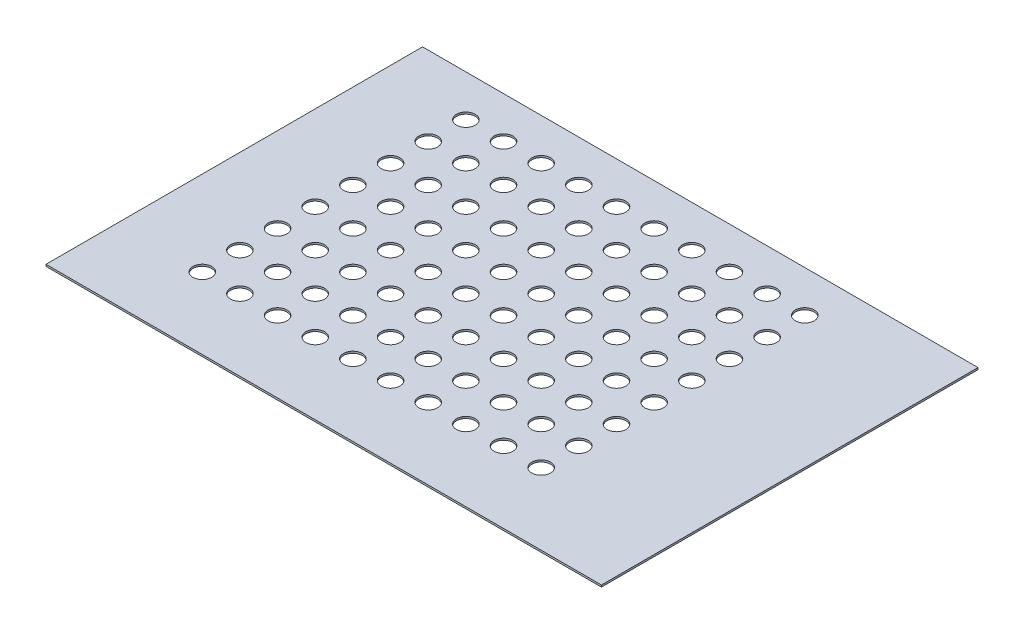
from build123d import *

# Parameters (mm, degrees)
SKETCH1_W          = 295
SKETCH1_H          = 200
BASE_FLANGE1_DEPTH = 1
SKETCH2_R          = 5
CUT_EXTRUDE1_DEPTH = 224.986144874


# Sheet-metal steps are written as plain solids
with BuildPart() as part:
    # Sketch1 → Base-Flange1 (new body)
    with BuildSketch(Plane(origin=(0, 0, 0), x_dir=(1, 0, 0), z_dir=(0, 1, 0))):
        with Locations((38.996598639, -24.047619048)):
            Rectangle(SKETCH1_W, SKETCH1_H)
    extrude(amount=-BASE_FLANGE1_DEPTH)

    # Sketch2 → Cut-Extrude1 (cut, through all)
    with BuildSketch(Plane(origin=(0, 0, 0), x_dir=(1, 0, 0), z_dir=(0, 1, 0))):
        with Locations(Location((-63.503401361, 53.952079096, 0), (0, 0, 270))):
            Circle(SKETCH2_R)
        with Locations(Location((-63.503401361, 33.952079096, 0), (0, 0, 270))):
            Circle(SKETCH2_R)
        with Locations(Location((-63.503401361, 13.952079096, 0), (0, 0, 270))):
            Circle(SKETCH2_R)
        with Locations(Location((-63.503401361, -6.047920904, 0), (0, 0, 270))):
            Circle(SKETCH2_R)
        with Locations(Location((-63.503401361, -26.047920904, 0), (0, 0, 270))):
            Circle(SKETCH2_R)
        with Locations(Location((-63.503401361, -46.047920904, 0), (0, 0, 270))):
            Circle(SKETCH2_R)
        with Locations(Location((-63.503401361, -66.047920904, 0), (0, 0, 270))):
            Circle(SKETCH2_R)
        with Locations(Location((-63.503401361, -86.047920904, 0), (0, 0, 270))):
            Circle(SKETCH2_R)
        with Locations(Location((-43.503401361, 53.952079096, 0), (0, 0, 270))):
            Circle(SKETCH2_R)
        with Locations(Location((-43.503401361, 33.952079096, 0), (0, 0, 270))):
            Circle(SKETCH2_R)
        with Locations(Location((-43.503401361, 13.952079096, 0), (0, 0, 270))):
            Circle(SKETCH2_R)
        with Locations(Location((-43.503401361, -6.047920904, 0), (0, 0, 270))):
            Circle(SKETCH2_R)
        with Locations(Location((-43.503401361, -26.047920904, 0), (0, 0, 270))):
            Circle(SKETCH2_R)
        with Locations(Location((-43.503401361, -46.047920904, 0), (0, 0, 270))):
            Circle(SKETCH2_R)
        with Locations(Location((-43.503401361, -66.047920904, 0), (0, 0, 270))):
            Circle(SKETCH2_R)
        with Locations(Location((-43.503401361, -86.047920904, 0), (0, 0, 270))):
            Circle(SKETCH2_R)
        with Locations(Location((-23.503401361, 53.952079096, 0), (0, 0, 270))):
            Circle(SKETCH2_R)
        with Locations(Location((-23.503401361, 33.952079096, 0), (0, 0, 270))):
            Circle(SKETCH2_R)
        with Locations(Location((-23.503401361, 13.952079096, 0), (0, 0, 270))):
            Circle(SKETCH2_R)
        with Locations(Location((-23.503401361, -6.047920904, 0), (0, 0, 270))):
            Circle(SKETCH2_R)
        with Locations(Location((-23.503401361, -26.047920904, 0), (0, 0, 270))):
            Circle(SKETCH2_R)
        with Locations(Location((-23.503401361, -46.047920904, 0), (0, 0, 270))):
            Circle(SKETCH2_R)
        with Locations(Location((-23.503401361, -66.047920904, 0), (0, 0, 270))):
            Circle(SKETCH2_R)
        with Locations(Location((-23.503401361, -86.047920904, 0), (0, 0, 270))):
            Circle(SKETCH2_R)
        with Locations(Location((-3.503401361, 53.952079096, 0), (0, 0, 270))):
            Circle(SKETCH2_R)
        with Locations(Location((-3.503401361, 33.952079096, 0), (0, 0, 270))):
            Circle(SKETCH2_R)
        with Locations(Location((-3.503401361, 13.952079096, 0), (0, 0, 270))):
            Circle(SKETCH2_R)
        with Locations(Location((-3.503401361, -6.047920904, 0), (0, 0, 270))):
            Circle(SKETCH2_R)
        with Locations(Location((-3.503401361, -26.047920904, 0), (0, 0, 270))):
            Circle(SKETCH2_R)
        with Locations(Location((-3.503401361, -46.047920904, 0), (0, 0, 270))):
            Circle(SKETCH2_R)
        with Locations(Location((-3.503401361, -66.047920904, 0), (0, 0, 270))):
            Circle(SKETCH2_R)
        with Locations(Location((-3.503401361, -86.047920904, 0), (0, 0, 270))):
            Circle(SKETCH2_R)
        with Locations(Location((16.496598639, 53.952079096, 0), (0, 0, 270))):
            Circle(SKETCH2_R)
        with Locations(Location((16.496598639, 33.952079096, 0), (0, 0, 270))):
            Circle(SKETCH2_R)
        with Locations(Location((16.496598639, 13.952079096, 0), (0, 0, 270))):
            Circle(SKETCH2_R)
        with Locations(Location((16.496598639, -6.047920904, 0), (0, 0, 270))):
            Circle(SKETCH2_R)
        with Locations(Location((16.496598639, -26.047920904, 0), (0, 0, 270))):
            Circle(SKETCH2_R)
        with Locations(Location((16.496598639, -46.047920904, 0), (0, 0, 270))):
            Circle(SKETCH2_R)
        with Locations(Location((16.496598639, -66.047920904, 0), (0, 0, 270))):
            Circle(SKETCH2_R)
        with Locations(Location((16.496598639, -86.047920904, 0), (0, 0, 270))):
            Circle(SKETCH2_R)
        with Locations(Location((36.496598639, 53.952079096, 0), (0, 0, 270))):
            Circle(SKETCH2_R)
        with Locations(Location((36.496598639, 33.952079096, 0), (0, 0, 270))):
            Circle(SKETCH2_R)
        with Locations(Location((36.496598639, 13.952079096, 0), (0, 0, 270))):
            Circle(SKETCH2_R)
        with Locations(Location((36.496598639, -6.047920904, 0), (0, 0, 270))):
            Circle(SKETCH2_R)
        with Locations(Location((36.496598639, -26.047920904, 0), (0, 0, 270))):
            Circle(SKETCH2_R)
        with Locations(Location((36.496598639, -46.047920904, 0), (0, 0, 270))):
            Circle(SKETCH2_R)
        with Locations(Location((36.496598639, -66.047920904, 0), (0, 0, 270))):
            Circle(SKETCH2_R)
        with Locations(Location((36.496598639, -86.047920904, 0), (0, 0, 270))):
            Circle(SKETCH2_R)
        with Locations(Location((56.496598639, 53.952079096, 0), (0, 0, 270))):
            Circle(SKETCH2_R)
        with Locations(Location((56.496598639, 33.952079096, 0), (0, 0, 270))):
            Circle(SKETCH2_R)
        with Locations(Location((56.496598639, 13.952079096, 0), (0, 0, 270))):
            Circle(SKETCH2_R)
        with Locations(Location((56.496598639, -6.047920904, 0), (0, 0, 270))):
            Circle(SKETCH2_R)
        with Locations(Location((56.496598639, -26.047920904, 0), (0, 0, 270))):
            Circle(SKETCH2_R)
        with Locations(Location((56.496598639, -46.047920904, 0), (0, 0, 270))):
            Circle(SKETCH2_R)
        with Locations(Location((56.496598639, -66.047920904, 0), (0, 0, 270))):
            Circle(SKETCH2_R)
        with Locations(Location((56.496598639, -86.047920904, 0), (0, 0, 270))):
            Circle(SKETCH2_R)
        with Locations(Location((76.496598639, 53.952079096, 0), (0, 0, 270))):
            Circle(SKETCH2_R)
        with Locations(Location((76.496598639, 33.952079096, 0), (0, 0, 270))):
            Circle(SKETCH2_R)
        with Locations(Location((76.496598639, 13.952079096, 0), (0, 0, 270))):
            Circle(SKETCH2_R)
        with Locations(Location((76.496598639, -6.047920904, 0), (0, 0, 270))):
            Circle(SKETCH2_R)
        with Locations(Location((76.496598639, -26.047920904, 0), (0, 0, 270))):
            Circle(SKETCH2_R)
        with Locations(Location((76.496598639, -46.047920904, 0), (0, 0, 270))):
            Circle(SKETCH2_R)
        with Locations(Location((76.496598639, -66.047920904, 0), (0, 0, 270))):
            Circle(SKETCH2_R)
        with Locations(Location((76.496598639, -86.047920904, 0), (0, 0, 270))):
            Circle(SKETCH2_R)
        with Locations(Location((96.496598639, 53.952079096, 0), (0, 0, 270))):
            Circle(SKETCH2_R)
        with Locations(Location((96.496598639, 33.952079096, 0), (0, 0, 270))):
            Circle(SKETCH2_R)
        with Locations(Location((96.496598639, 13.952079096, 0), (0, 0, 270))):
            Circle(SKETCH2_R)
        with Locations(Location((96.496598639, -6.047920904, 0), (0, 0, 270))):
            Circle(SKETCH2_R)
        with Locations(Location((96.496598639, -26.047920904, 0), (0, 0, 270))):
            Circle(SKETCH2_R)
        with Locations(Location((96.496598639, -46.047920904, 0), (0, 0, 270))):
            Circle(SKETCH2_R)
        with Locations(Location((96.496598639, -66.047920904, 0), (0, 0, 270))):
            Circle(SKETCH2_R)
        with Locations(Location((96.496598639, -86.047920904, 0), (0, 0, 270))):
            Circle(SKETCH2_R)
        with Locations(Location((116.496598639, 53.952079096, 0), (0, 0, 270))):
            Circle(SKETCH2_R)
        with Locations(Location((116.496598639, 33.952079096, 0), (0, 0, 270))):
            Circle(SKETCH2_R)
        with Locations(Location((116.496598639, 13.952079096, 0), (0, 0, 270))):
            Circle(SKETCH2_R)
        with Locations(Location((116.496598639, -6.047920904, 0), (0, 0, 270))):
            Circle(SKETCH2_R)
        with Locations(Location((116.496598639, -26.047920904, 0), (0, 0, 270))):
            Circle(SKETCH2_R)
        with Locations(Location((116.496598639, -46.047920904, 0), (0, 0, 270))):
            Circle(SKETCH2_R)
        with Locations(Location((116.496598639, -66.047920904, 0), (0, 0, 270))):
            Circle(SKETCH2_R)
        with Locations(Location((116.496598639, -86.047920904, 0), (0, 0, 270))):
            Circle(SKETCH2_R)
    extrude(amount=-CUT_EXTRUDE1_DEPTH, mode=Mode.SUBTRACT)


solid = part.part
